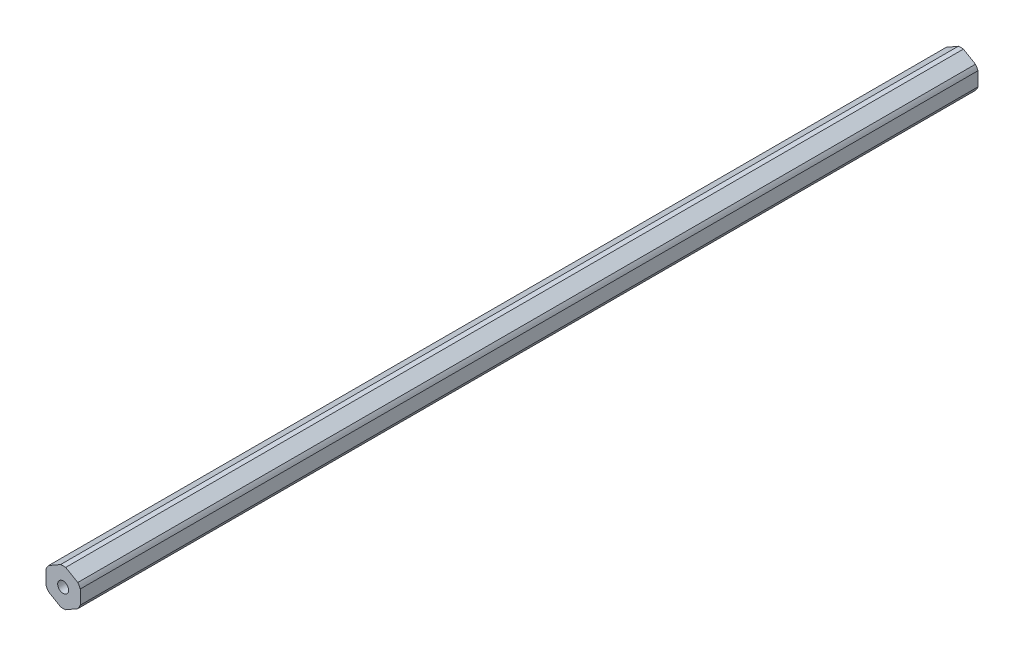
from build123d import *

# Parameters (mm, degrees)
BOSS_EXTRUDE1_DEPTH = 166.1795
SKETCH2_R           = 2.0193
CUT_EXTRUDE1_DEPTH  = 333.490390154


with BuildPart() as part:
    # Sketch1 → Boss-Extrude1 (new, symmetric)
    with BuildSketch(Plane.XY):
        with BuildLine():
            ThreePointArc((0.93173274, 6.79441227), (0, 6.858), (-0.93173274, 6.79441227))
            Line((-0.93173274, 6.79441227), (-5.41826726, 4.204110358))
            ThreePointArc((-5.41826726, 4.204110358), (-5.939202219, 3.429), (-6.35, 2.590301913))
            Line((-6.35, 2.590301913), (-6.35, -2.590301913))
            ThreePointArc((-6.35, -2.590301913), (-5.939202219, -3.429), (-5.41826726, -4.204110358))
            Line((-5.41826726, -4.204110358), (-0.93173274, -6.79441227))
            ThreePointArc((-0.93173274, -6.79441227), (0, -6.858), (0.93173274, -6.79441227))
            Line((0.93173274, -6.79441227), (5.41826726, -4.204110358))
            ThreePointArc((5.41826726, -4.204110358), (5.939202219, -3.429), (6.35, -2.590301913))
            Line((6.35, -2.590301913), (6.35, 2.590301913))
            ThreePointArc((6.35, 2.590301913), (5.939202219, 3.429), (5.41826726, 4.204110358))
            Line((5.41826726, 4.204110358), (0.93173274, 6.79441227))
        make_face()
    extrude(amount=BOSS_EXTRUDE1_DEPTH, both=True)

    # Sketch2 → Cut-Extrude1 (cut, through all)
    with BuildSketch(Plane.XY.offset(166.1795)):
        Circle(SKETCH2_R)
    extrude(amount=-CUT_EXTRUDE1_DEPTH, mode=Mode.SUBTRACT)


solid = part.part
